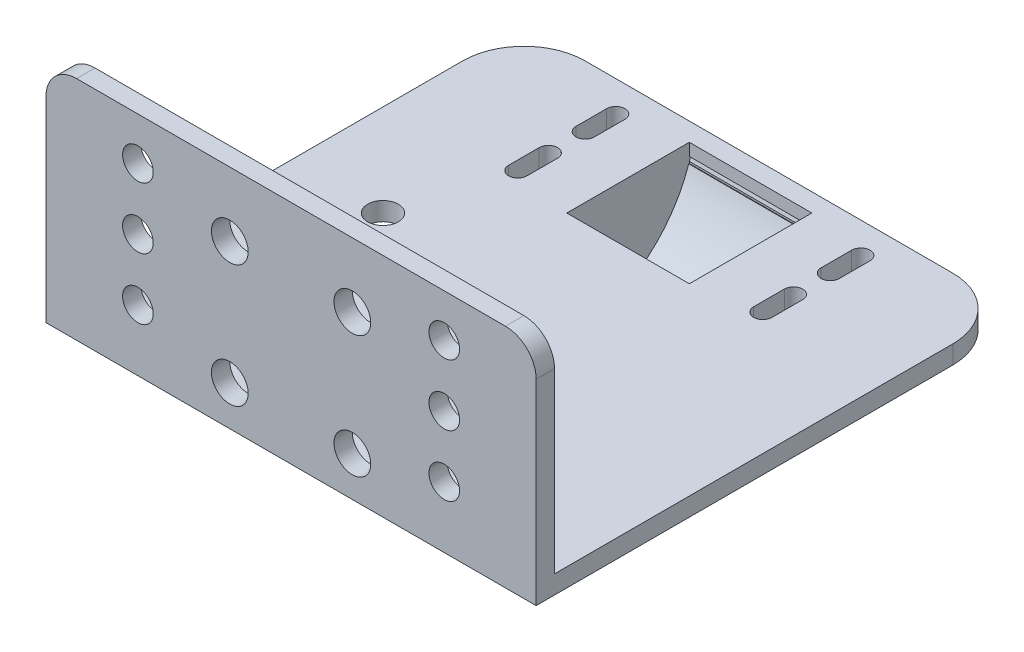
from build123d import *

# Parameters (mm, degrees)
SZKIC2_W                    = 80
SZKIC2_H                    = 37
SZKIC2_R                    = 3
SZKIC2_R_2                  = 2.5
DODANIE_WYCI_GNI_CIE1_DEPTH = 3
ZAOKR_GLENIE1_R             = 5
SZKIC3_W                    = 80
SZKIC3_H                    = 3
DODANIE_WYCI_GNI_CIE2_DEPTH = 75
WYTNIJ_WYCI_GNI_CIE1_REACH  = 94.704
DODANIE_WYCI_GNI_CIE3_DEPTH = 24
SKORUPA8_START              = -10
SKORUPA8_DEPTH              = 20
SZKIC10_W                   = 20
SZKIC10_H                   = 20
WYTNIJ_WYCI_GNI_CIE5_DEPTH  = 3
SZKIC4_5_R                  = 1.5
WYTNIJ_WYCI_GNI_CIE7_DEPTH  = 3
ZAOKR_GLENIE2_R             = 10
WYTNIJ_WYCI_GNI_CIE8_REACH  = 94.704
SZKIC11_R                   = 2.5


# Read off the part's stored shape, not the designer's step: Skorupa8
with BuildPart() as part:
    # Szkic2 → Dodanie-wyciągnięcie1 (new body)
    with BuildSketch(Plane.XY):
        Rectangle(SZKIC2_W, SZKIC2_H)
        with Locations((-10, -12)):
            Circle(SZKIC2_R, mode=Mode.SUBTRACT)
        with Locations((-25, -8.5)):
            Circle(SZKIC2_R_2, mode=Mode.SUBTRACT)
        with Locations((-25, 1.5)):
            Circle(SZKIC2_R_2, mode=Mode.SUBTRACT)
        with Locations((-25, 11.5)):
            Circle(SZKIC2_R_2, mode=Mode.SUBTRACT)
        with Locations(Location((10, -12, 0), (0, 0, 180))):
            Circle(SZKIC2_R, mode=Mode.SUBTRACT)
        with Locations(Location((25, -8.5, 0), (0, 0, 180))):
            Circle(SZKIC2_R_2, mode=Mode.SUBTRACT)
        with Locations(Location((25, 1.5, 0), (0, 0, 180))):
            Circle(SZKIC2_R_2, mode=Mode.SUBTRACT)
        with Locations(Location((25, 11.5, 0), (0, 0, 180))):
            Circle(SZKIC2_R_2, mode=Mode.SUBTRACT)
        with Locations((-10, 8)):
            Circle(SZKIC2_R, mode=Mode.SUBTRACT)
        with Locations(Location((10, 8, 0), (0, 0, 180))):
            Circle(SZKIC2_R, mode=Mode.SUBTRACT)
    extrude(amount=DODANIE_WYCI_GNI_CIE1_DEPTH)

    # Zaokrąglenie1
    zaokr_glenie1_edges = [part.edges().sort_by_distance(p)[0] for p in [
        (-40, 18.5, 1.5),
        (40, 18.5, 1.5),
    ]]
    fillet(zaokr_glenie1_edges, radius=ZAOKR_GLENIE1_R)

    # Szkic3 → Dodanie-wyciągnięcie2 (add)
    with BuildSketch(Plane(origin=(0, 0, 0), x_dir=(-1, 0, 0), z_dir=(0, 0, -1))):
        with Locations((0, -17)):
            Rectangle(SZKIC3_W, SZKIC3_H)
    extrude(amount=DODANIE_WYCI_GNI_CIE2_DEPTH)

    # Szkic4 → Wytnij-wyciągnięcie1 (cut, up to next)
    with BuildSketch(Plane.XZ.offset(18.5), mode=Mode.PRIVATE) as wytnij_wyci_gni_cie1_sk1:
        with BuildLine():
            Line((-21.5, -65), (-21.5, -70))
            ThreePointArc((-21.5, -70), (-20, -71.5), (-18.5, -70))
            Line((-18.5, -70), (-18.5, -65))
            ThreePointArc((-18.5, -65), (-20, -63.5), (-21.5, -65))
        make_face()
    wytnij_wyci_gni_cie1_tool1 = extrude(wytnij_wyci_gni_cie1_sk1.sketch, amount=-WYTNIJ_WYCI_GNI_CIE1_REACH, mode=Mode.PRIVATE) & part.part
    # Szkic4 → Wytnij-wyciągnięcie1 (cut, up to next)
    with BuildSketch(Plane.XZ.offset(18.5), mode=Mode.PRIVATE) as wytnij_wyci_gni_cie1_sk2:
        with BuildLine():
            ThreePointArc((-18.5, -54), (-20, -52.5), (-21.5, -54))
            Line((-21.5, -54), (-21.5, -59))
            ThreePointArc((-21.5, -59), (-20, -60.5), (-18.5, -59))
            Line((-18.5, -59), (-18.5, -54))
        make_face()
    wytnij_wyci_gni_cie1_tool2 = extrude(wytnij_wyci_gni_cie1_sk2.sketch, amount=-WYTNIJ_WYCI_GNI_CIE1_REACH, mode=Mode.PRIVATE) & part.part
    # Szkic4 → Wytnij-wyciągnięcie1 (cut, up to next)
    with BuildSketch(Plane.XZ.offset(18.5), mode=Mode.PRIVATE) as wytnij_wyci_gni_cie1_sk3:
        with BuildLine():
            ThreePointArc((21.5, -54), (20, -52.5), (18.5, -54))
            Line((18.5, -54), (18.5, -59))
            ThreePointArc((18.5, -59), (20, -60.5), (21.5, -59))
            Line((21.5, -59), (21.5, -54))
        make_face()
    wytnij_wyci_gni_cie1_tool3 = extrude(wytnij_wyci_gni_cie1_sk3.sketch, amount=-WYTNIJ_WYCI_GNI_CIE1_REACH, mode=Mode.PRIVATE) & part.part
    # Szkic4 → Wytnij-wyciągnięcie1 (cut, up to next)
    with BuildSketch(Plane.XZ.offset(18.5), mode=Mode.PRIVATE) as wytnij_wyci_gni_cie1_sk4:
        with BuildLine():
            Line((18.5, -65), (18.5, -70))
            ThreePointArc((18.5, -70), (20, -71.5), (21.5, -70))
            Line((21.5, -70), (21.5, -65))
            ThreePointArc((21.5, -65), (20, -63.5), (18.5, -65))
        make_face()
    wytnij_wyci_gni_cie1_tool4 = extrude(wytnij_wyci_gni_cie1_sk4.sketch, amount=-WYTNIJ_WYCI_GNI_CIE1_REACH, mode=Mode.PRIVATE) & part.part
    add(wytnij_wyci_gni_cie1_tool1.solids().sort_by_distance((-20, -18.5, -67.5))[0], mode=Mode.SUBTRACT)
    add(wytnij_wyci_gni_cie1_tool2.solids().sort_by_distance((-20, -18.5, -56.5))[0], mode=Mode.SUBTRACT)
    add(wytnij_wyci_gni_cie1_tool3.solids().sort_by_distance((20, -18.5, -56.5))[0], mode=Mode.SUBTRACT)
    add(wytnij_wyci_gni_cie1_tool4.solids().sort_by_distance((20, -18.5, -67.5))[0], mode=Mode.SUBTRACT)

    # Szkic8 → Dodanie-wyciągnięcie3 (add)
    with BuildSketch(Plane(origin=(12, 0, 0), x_dir=(0, 0, -1), z_dir=(1, 0, 0))):
        with BuildLine():
            Line((50, -18.5), (50, -35.5))
            ThreePointArc((50, -35.5), (64.90911692, -31.106988593), (74, -18.5))
            Line((74, -18.5), (50, -18.5))
        make_face()
    extrude(amount=-DODANIE_WYCI_GNI_CIE3_DEPTH)

    # Skorupa8 outline → Skorupa8 (cut)
    with BuildSketch(Plane.YZ.offset(SKORUPA8_START)):
        with BuildLine():
            Line((-17.5, -72.209048527), (-17.5, -50))
            Line((-17.5, -50), (-33.497961371, -50))
            ThreePointArc((-33.497961371, -50), (-29.37331804, -63.895346178), (-17.5, -72.209048527))
        make_face()
    extrude(amount=SKORUPA8_DEPTH, mode=Mode.SUBTRACT)

    # Szkic10 → Wytnij-wyciągnięcie5 (cut)
    with BuildSketch(Plane(origin=(0, -15.5, 0), x_dir=(1, 0, 0), z_dir=(0, 1, 0))):
        with Locations((0, 62)):
            Rectangle(SZKIC10_W, SZKIC10_H)
    extrude(amount=-WYTNIJ_WYCI_GNI_CIE5_DEPTH, mode=Mode.SUBTRACT)

    # Szkic4<5> → Wytnij-wyciągnięcie7 (cut)
    with BuildSketch(Plane.XZ.offset(18.5)):
        with Locations(Location((-5.5, -7, 0), (0, 0, 270))):
            Circle(SZKIC4_5_R)
    extrude(amount=-WYTNIJ_WYCI_GNI_CIE7_DEPTH, mode=Mode.SUBTRACT)

    # Zaokrąglenie2
    zaokr_glenie2_edges = [part.edges().sort_by_distance(p)[0] for p in [
        (40, -17, -75),
        (-40, -17, -75),
    ]]
    fillet(zaokr_glenie2_edges, radius=ZAOKR_GLENIE2_R)

    # Szkic11 → Wytnij-wyciągnięcie8 (cut, up to next)
    with BuildSketch(Plane.XZ.offset(18.5), mode=Mode.PRIVATE) as wytnij_wyci_gni_cie8_sk1:
        with Locations(Location((-25, -7, 0), (0, 0, 270))):
            Circle(SZKIC11_R)
    wytnij_wyci_gni_cie8_tool1 = extrude(wytnij_wyci_gni_cie8_sk1.sketch, amount=-WYTNIJ_WYCI_GNI_CIE8_REACH, mode=Mode.PRIVATE) & part.part
    # Szkic11 → Wytnij-wyciągnięcie8 (cut, up to next)
    with BuildSketch(Plane.XZ.offset(18.5), mode=Mode.PRIVATE) as wytnij_wyci_gni_cie8_sk2:
        with Locations(Location((-25, -17, 0), (0, 0, 270))):
            Circle(SZKIC11_R)
    wytnij_wyci_gni_cie8_tool2 = extrude(wytnij_wyci_gni_cie8_sk2.sketch, amount=-WYTNIJ_WYCI_GNI_CIE8_REACH, mode=Mode.PRIVATE) & part.part
    # Szkic11 → Wytnij-wyciągnięcie8 (cut, up to next)
    with BuildSketch(Plane.XZ.offset(18.5), mode=Mode.PRIVATE) as wytnij_wyci_gni_cie8_sk3:
        with Locations(Location((-25, -27, 0), (0, 0, 270))):
            Circle(SZKIC11_R)
    wytnij_wyci_gni_cie8_tool3 = extrude(wytnij_wyci_gni_cie8_sk3.sketch, amount=-WYTNIJ_WYCI_GNI_CIE8_REACH, mode=Mode.PRIVATE) & part.part
    # Szkic11 → Wytnij-wyciągnięcie8 (cut, up to next)
    with BuildSketch(Plane.XZ.offset(18.5), mode=Mode.PRIVATE) as wytnij_wyci_gni_cie8_sk4:
        with Locations(Location((-25, -37, 0), (0, 0, 270))):
            Circle(SZKIC11_R)
    wytnij_wyci_gni_cie8_tool4 = extrude(wytnij_wyci_gni_cie8_sk4.sketch, amount=-WYTNIJ_WYCI_GNI_CIE8_REACH, mode=Mode.PRIVATE) & part.part
    add(wytnij_wyci_gni_cie8_tool1.solids().sort_by_distance((-25, -18.5, -7))[0], mode=Mode.SUBTRACT)
    add(wytnij_wyci_gni_cie8_tool2.solids().sort_by_distance((-25, -18.5, -17))[0], mode=Mode.SUBTRACT)
    add(wytnij_wyci_gni_cie8_tool3.solids().sort_by_distance((-25, -18.5, -27))[0], mode=Mode.SUBTRACT)
    add(wytnij_wyci_gni_cie8_tool4.solids().sort_by_distance((-25, -18.5, -37))[0], mode=Mode.SUBTRACT)


solid = part.part
